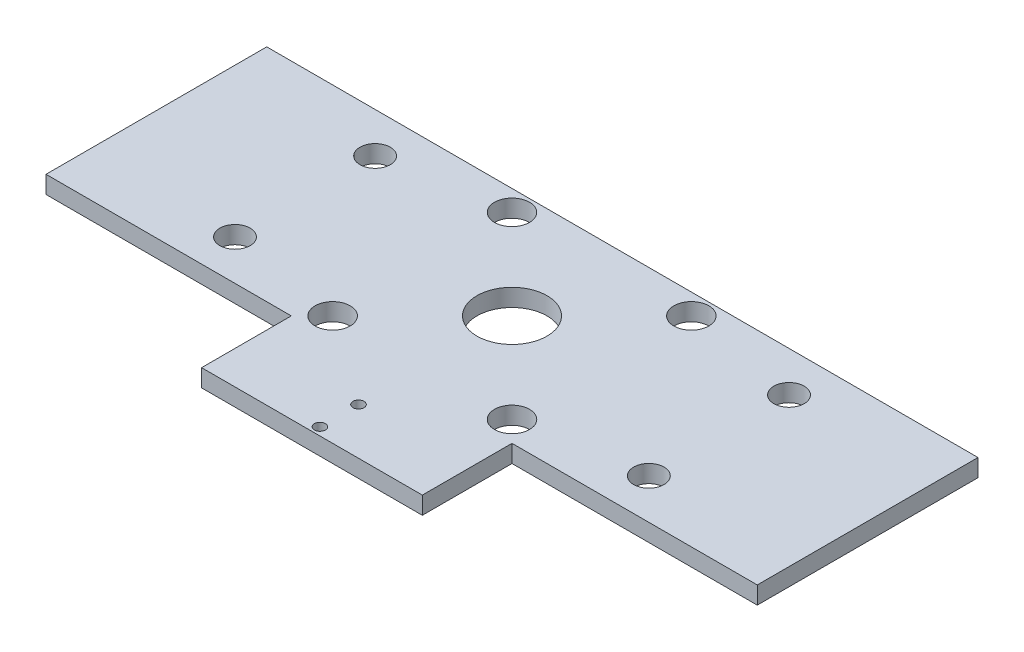
from build123d import *

# Parameters (mm, degrees)
BOSS_EXTRUDE1_DEPTH        = 3.175
F_1_1_DIAMETER_HOLE1_D     = 25.4
F_1_2_0_5_DIAMETER_HOLE1_D = 12.7
F_4_0_4_DIAMETER_HOLE1_D   = 4
M10_CLEARANCE_HOLE1_D      = 11


with BuildPart() as part:
    # Sketch1 → Boss-Extrude1 (new, symmetric)
    with BuildSketch(Plane(origin=(0, 0, 0), x_dir=(1, 0, 0), z_dir=(0, 1, 0))):
        Polygon((40, -40), (128.9, -40), (128.9, 40), (-128.9, 40), (-128.9, -40), (-40, -40), (-40, -72.5), (40, -72.5), align=None)
    extrude(amount=BOSS_EXTRUDE1_DEPTH, both=True)

    # 1 (1) Diameter Hole1 (through all)
    with Locations(Plane(origin=(0, 3.175, 0), x_dir=(1, 0, 0), z_dir=(0, 1, 0))):
        with Locations((0, 0)):
            Hole(F_1_1_DIAMETER_HOLE1_D / 2)

    # 1/2 (0.5) Diameter Hole1 (through all)
    with Locations(Plane(origin=(0, 3.175, 0), x_dir=(1, 0, 0), z_dir=(0, 1, 0))):
        with Locations((32.5, -32.5), (-32.5, 32.5), (-32.5, -32.5), (32.5, 32.5)):
            Hole(F_1_2_0_5_DIAMETER_HOLE1_D / 2)

    # Ø4.0 (4) Diameter Hole1 (through all)
    with Locations(Plane(origin=(0, 3.175, 0), x_dir=(1, 0, 0), z_dir=(0, 1, 0))):
        with Locations((0, -55.63), (0, -69.63)):
            Hole(F_4_0_4_DIAMETER_HOLE1_D / 2)

    # M10 Clearance Hole1 (through all)
    with Locations(Plane(origin=(0, 3.175, 0), x_dir=(1, 0, 0), z_dir=(0, 1, 0))):
        with Locations((75, -25.4), (-75, 25.4), (-75, -25.4), (75, 25.4)):
            Hole(M10_CLEARANCE_HOLE1_D / 2)


solid = part.part
